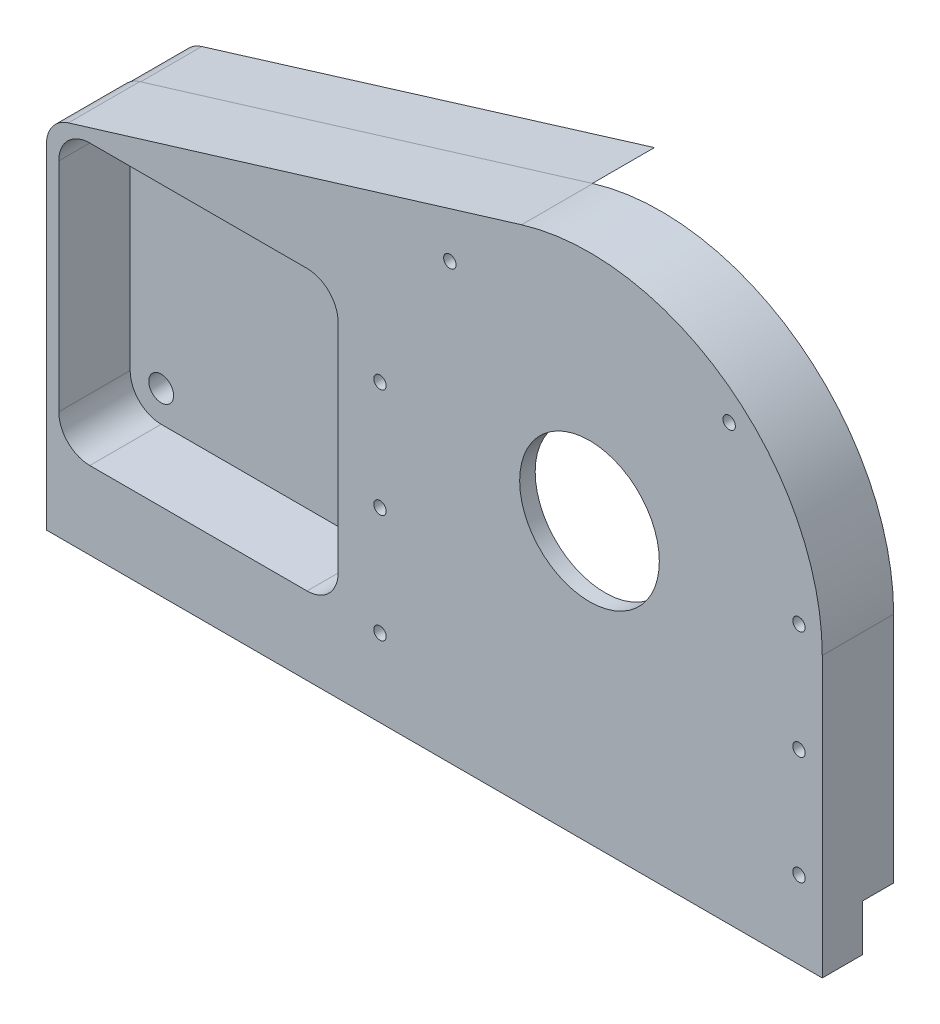
from build123d import *

# Parameters (mm, degrees)
BOSS_EXTRUDE8_DEPTH  = 5
SKETCH18_W           = 250
SKETCH18_H           = 15
BOSS_EXTRUDE9_DEPTH  = 8
SKETCH19_R           = 22.5
SKETCH19_R_2         = 2
CUT_EXTRUDE4_DEPTH   = 8
SKETCH20_R           = 2
CUT_EXTRUDE5_DEPTH   = 8
BOSS_EXTRUDE11_START = 18
BOSS_EXTRUDE11_DEPTH = 18
SKETCH22_W           = 104
SKETCH22_H           = 15.211863575
BOSS_EXTRUDE12_DEPTH = 10
CUT_EXTRUDE6_DEPTH   = 10
BOSS_EXTRUDE13_DEPTH = 20
SKETCH26_R           = 4
CUT_EXTRUDE7_DEPTH   = 30
SKETCH27_W           = 4
SKETCH27_H           = 15
CUT_EXTRUDE8_DEPTH   = 10


# Read off the part's stored shape, not the designer's step: Boss-Extrude13
with BuildPart() as part:
    # Sketch13 → Boss-Extrude8 (new body)
    with BuildSketch(Plane.XY):
        with BuildLine():
            Line((-167.919375153, 27.161249695), (-21.895313644, 71.732804493))
            ThreePointArc((-21.895313644, 71.732804493), (44.625393425, 60.279136205), (75, 0))
            Line((75, 0), (75, -75))
            Line((75, -75), (75, -90))
            Line((75, -90), (-175, -90))
            Line((-175, -90), (-175, -75))
            Line((-175, -75), (-175, 17.596875763))
            ThreePointArc((-175, 17.596875763), (-173.037218161, 23.546928219), (-167.919375153, 27.161249695))
        make_face()
    extrude(amount=BOSS_EXTRUDE8_DEPTH)

    # Sketch18 → Boss-Extrude9 (add)
    with BuildSketch(Plane(origin=(0, 0, 0), x_dir=(-1, 0, 0), z_dir=(0, 0, -1))):
        with Locations((50, -82.5)):
            Rectangle(SKETCH18_W, SKETCH18_H)
    extrude(amount=BOSS_EXTRUDE9_DEPTH)

    # Sketch19 → Cut-Extrude4 (cut)
    with BuildSketch(Plane(origin=(0, 0, 0), x_dir=(-1, 0, 0), z_dir=(0, 0, -1))):
        Circle(SKETCH19_R)
        with Locations((-67.5, -65)):
            Circle(SKETCH19_R_2)
        with Locations((67.5, -65)):
            Circle(SKETCH19_R_2)
        with Locations((67.5, -30)):
            Circle(SKETCH19_R_2)
        with Locations((67.5, 5)):
            Circle(SKETCH19_R_2)
        with Locations((-67.5, -30)):
            Circle(SKETCH19_R_2)
        with Locations((-67.5, 5)):
            Circle(SKETCH19_R_2)
    extrude(amount=-CUT_EXTRUDE4_DEPTH, mode=Mode.SUBTRACT)

    # Sketch20 → Cut-Extrude5 (cut)
    with BuildSketch(Plane(origin=(0, 0, 0), x_dir=(-1, 0, 0), z_dir=(0, 0, -1))):
        with Locations((-45, 50)):
            Circle(SKETCH20_R)
        with Locations((45, 50)):
            Circle(SKETCH20_R)
    extrude(amount=-CUT_EXTRUDE5_DEPTH, mode=Mode.SUBTRACT)

    # Sketch21 → Boss-Extrude11 (add)
    with BuildSketch(Plane(origin=(0, 0, 0), x_dir=(-1, 0, 0), z_dir=(0, 0, -1)).offset(BOSS_EXTRUDE11_START)):
        with BuildLine():
            Line((167.919375153, 27.161249695), (21.895313644, 71.732804493))
            ThreePointArc((21.895313644, 71.732804493), (51.864787491, 54.176044692), (70.710678119, 25))
            Line((70.710678119, 25), (91, 25))
            Line((91, 25), (161, 25))
            ThreePointArc((161, 25), (168.071067812, 22.071067812), (171, 15))
            Line((171, 15), (171, -55))
            ThreePointArc((171, -55), (168.071067812, -62.071067812), (161, -65))
            Line((161, -65), (91, -65))
            ThreePointArc((91, -65), (83.928932188, -62.071067812), (81, -55))
            Line((81, -55), (81, -50))
            Line((81, -50), (71, -50))
            Line((71, -50), (71, -75))
            Line((71, -75), (75, -75))
            Line((75, -75), (85, -75))
            Line((85, -75), (175, -75))
            Line((175, -75), (175, 17.596875763))
            ThreePointArc((175, 17.596875763), (173.037218161, 23.546928219), (167.919375153, 27.161249695))
        make_face()
        with BuildLine():
            ThreePointArc((21.895313644, 71.732804493), (-44.625393425, 60.279136205), (-75, 0))
            Line((-75, 0), (-75, -75))
            Line((-75, -75), (-71, -75))
            Line((-71, -75), (-71, 0))
            ThreePointArc((-71, 0), (-12.705070757, 69.853999006), (66.452990903, 25))
            Line((66.452990903, 25), (70.710678119, 25))
            ThreePointArc((70.710678119, 25), (51.864787491, 54.176044692), (21.895313644, 71.732804493))
        make_face()
    extrude(amount=-BOSS_EXTRUDE11_DEPTH)

    # Sketch22 → Boss-Extrude12 (add)
    with BuildSketch(Plane(origin=(0, 0, -8), x_dir=(-1, 0, 0), z_dir=(0, 0, -1))):
        with Locations((123, -82.605931787)):
            Rectangle(SKETCH22_W, SKETCH22_H)
    extrude(amount=BOSS_EXTRUDE12_DEPTH)

    # Sketch24 → Cut-Extrude6 (cut)
    with BuildSketch(Plane(origin=(0, 0, 0), x_dir=(-1, 0, 0), z_dir=(0, 0, -1))):
        with BuildLine():
            Line((91, 25), (161, 25))
            ThreePointArc((161, 25), (168.071067812, 22.071067812), (171, 15))
            Line((171, 15), (171, -55))
            ThreePointArc((171, -55), (168.071067812, -62.071067812), (161, -65))
            Line((161, -65), (91, -65))
            ThreePointArc((91, -65), (83.928932188, -62.071067812), (81, -55))
            Line((81, -55), (81, 15))
            ThreePointArc((81, 15), (83.928932188, 22.071067812), (91, 25))
        make_face()
    extrude(amount=-CUT_EXTRUDE6_DEPTH, mode=Mode.SUBTRACT)

    # Boss-Extrude13 outline → Boss-Extrude13 (add)
    with BuildSketch(Plane(origin=(0, 0, -18), x_dir=(-1, 0, 0), z_dir=(0, 0, -1))):
        with BuildLine():
            Line((175, -90.211863575), (175, 17.394801859))
            ThreePointArc((175, 17.394801859), (173.040981021, 23.339768152), (167.931475155, 26.955474085))
            Line((167.931475155, 26.955474085), (22.076778478, 71.67716409))
            ThreePointArc((22.076778478, 71.67716409), (60.335554965, 44.549083123), (75, 0))
            Line((75, 0), (75, -90.211863575))
            Line((75, -90.211863575), (175, -90.211863575))
        make_face()
    extrude(amount=BOSS_EXTRUDE13_DEPTH)

    # Sketch26 → Cut-Extrude7 (cut)
    with BuildSketch(Plane(origin=(0, 0, -38), x_dir=(-1, 0, 0), z_dir=(0, 0, -1))):
        with Locations((161, 15)):
            Circle(SKETCH26_R)
        with Locations((91, 15)):
            Circle(SKETCH26_R)
        with Locations((91, -55)):
            Circle(SKETCH26_R)
        with Locations((161, -55)):
            Circle(SKETCH26_R)
    extrude(amount=-CUT_EXTRUDE7_DEPTH, mode=Mode.SUBTRACT)

    # Sketch27 → Cut-Extrude8 (cut)
    with BuildSketch(Plane(origin=(0, 0, -18), x_dir=(-1, 0, 0), z_dir=(0, 0, -1))):
        with Locations((73, -82.711863575)):
            Rectangle(SKETCH27_W, SKETCH27_H)
    extrude(amount=-CUT_EXTRUDE8_DEPTH, mode=Mode.SUBTRACT)


solid = part.part
